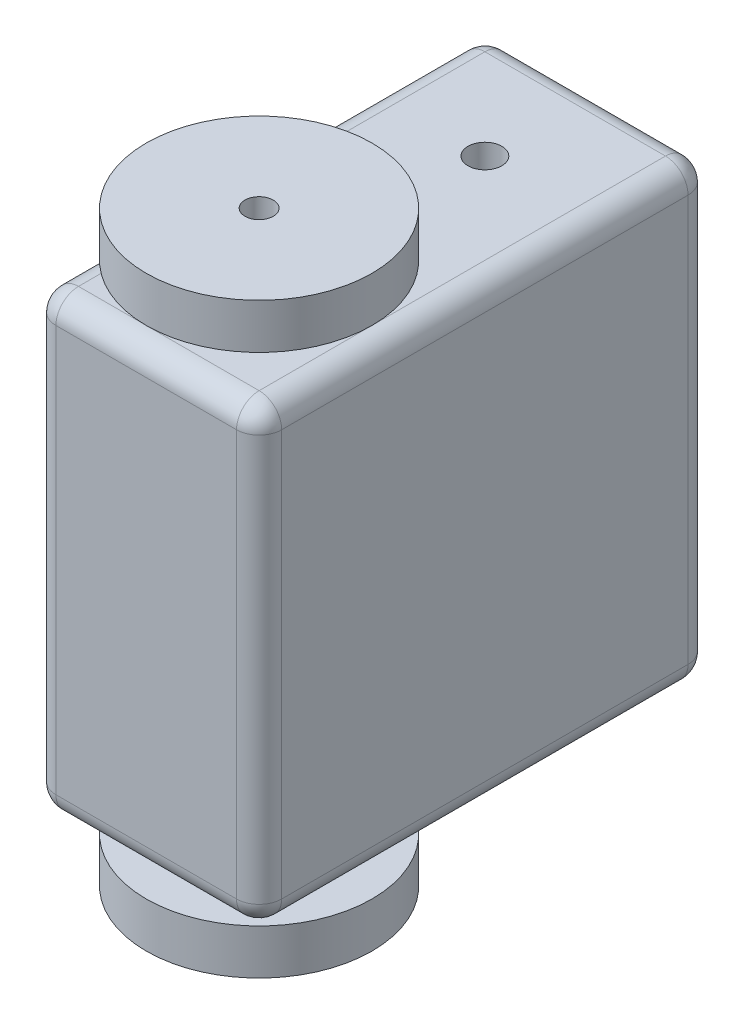
from build123d import *

# Parameters (mm, degrees)
SKETCH_1_W          = 40
SKETCH_1_H          = 40
EXTRUDE_1_DEPTH     = 10
SKETCH_2_R          = 5
EXTRUDE_2_DEPTH     = 1
SKETCH_3_R          = 2.5
EXTRUDE_3_DEPTH     = 1
SKETCH_4_R          = 10
EXTRUDE_4_DEPTH     = 4
CUT_EXTRUDE_START   = -46
SKETCH_5_R          = 1.25
CUT_EXTRUDE_1_DEPTH = 46
FILLET_1_R          = 2
SKETCH_6_R          = 1.5
CUT_EXTRUDE_2_DEPTH = 3


with BuildPart() as part:
    # 草图1 → 凸台-拉伸1 (new, symmetric)
    with BuildSketch(Plane(origin=(0, 0, 0), x_dir=(0, 0, -1), z_dir=(1, 0, 0))):
        Rectangle(SKETCH_1_W, SKETCH_1_H)
    extrude(amount=EXTRUDE_1_DEPTH, both=True)

    # 草图2 → 凸台-拉伸2 (add)
    with BuildSketch(Plane(origin=(0, 20, 0), x_dir=(1, 0, 0), z_dir=(0, 1, 0))):
        with Locations(Location((0, -10, 0), (0, 0, 90))):
            Circle(SKETCH_2_R)
    extrude_2 = extrude(amount=EXTRUDE_2_DEPTH)

    # 草图3 → 凸台-拉伸3 (add)
    with BuildSketch(Plane(origin=(0, 21, 0), x_dir=(1, 0, 0), z_dir=(0, 1, 0))):
        with Locations(Location((0, -10, 0), (0, 0, 270))):
            Circle(SKETCH_3_R)
    extrude_3 = extrude(amount=EXTRUDE_3_DEPTH)

    # 草图4 → 凸台-拉伸4 (add)
    with BuildSketch(Plane(origin=(0, 22, 0), x_dir=(1, 0, 0), z_dir=(0, 1, 0))):
        with Locations(Location((0, -10, 0), (0, 0, 270))):
            Circle(SKETCH_4_R)
    extrude_4 = extrude(amount=EXTRUDE_4_DEPTH)

    # 草图5 → 切除-拉伸1 (cut)
    with BuildSketch(Plane(origin=(0, 26, 0), x_dir=(1, 0, 0), z_dir=(0, 1, 0)).offset(CUT_EXTRUDE_START)):
        with Locations(Location((0, -10, 0), (0, 0, 270))):
            Circle(SKETCH_5_R)
    cut_extrude_1 = extrude(amount=CUT_EXTRUDE_1_DEPTH, mode=Mode.SUBTRACT)

    # 镜向1: 凸台-拉伸2, 凸台-拉伸3, 凸台-拉伸4, 切除-拉伸1 across plane
    add(extrude_2.mirror(Plane.ZX))
    add(extrude_3.mirror(Plane.ZX))
    add(extrude_4.mirror(Plane.ZX))
    add(cut_extrude_1.mirror(Plane.ZX), mode=Mode.SUBTRACT)

    # 圆角1
    # the kernel refuses this fillet: 2 mm, written as the material it adds along each edge
    with BuildSketch(Plane(origin=(0, 20, 10), x_dir=(0, 0, -1), z_dir=(1, 0, 0))) as fillet_1_piece_1:
        with BuildLine():
            CenterArc((6.732050808, 2), FILLET_1_R, 210, 60)
            Line((6.732050808, 0), (5, 0))
            Line((5, 0), (5, 1))
        make_face()
    revolve(axis=Axis((0, 20, 10), (0, 1, 0)))
    # the kernel refuses this fillet: 2 mm, written as the material it takes off along each edge
    with BuildSketch(Plane(origin=(8, 18, -18), x_dir=(0, 0, -1), z_dir=(0, 1, 0))) as fillet_1_2_piece_1_section:
        Polygon((0, 0), (FILLET_1_R * 1.02, 0), (FILLET_1_R * 1.02, -FILLET_1_R * 1.02), (0, -FILLET_1_R * 1.02), align=None)
    fillet_1_2_piece_1 = extrude(amount=FILLET_1_R * 1.02, mode=Mode.PRIVATE)
    fillet_1_2_piece_1 = fillet_1_2_piece_1 - Plane(origin=(8, 18, -18), x_dir=(-0.7071067811865475, 0, 0.7071067811865475), z_dir=(0, 1, 0)) * Sphere(FILLET_1_R, mode=Mode.PRIVATE)
    add(fillet_1_2_piece_1, mode=Mode.SUBTRACT)
    with BuildSketch(Plane(origin=(8, -18, -18), x_dir=(0, 0, -1), z_dir=(0, -1, 0))) as fillet_1_2_piece_2_section:
        Polygon((0, 0), (FILLET_1_R * 1.02, 0), (FILLET_1_R * 1.02, FILLET_1_R * 1.02), (0, FILLET_1_R * 1.02), align=None)
    fillet_1_2_piece_2 = extrude(amount=FILLET_1_R * 1.02, mode=Mode.PRIVATE)
    fillet_1_2_piece_2 = fillet_1_2_piece_2 - Plane(origin=(8, -18, -18), x_dir=(-0.7071067811865475, 0, 0.7071067811865475), z_dir=(0, -1, 0)) * Sphere(FILLET_1_R, mode=Mode.PRIVATE)
    add(fillet_1_2_piece_2, mode=Mode.SUBTRACT)
    with BuildSketch(Plane(origin=(8, 18, 18), x_dir=(1, 0, 0), z_dir=(0, 1, 0))) as fillet_1_2_piece_3_section:
        Polygon((0, 0), (FILLET_1_R * 1.02, 0), (FILLET_1_R * 1.02, -FILLET_1_R * 1.02), (0, -FILLET_1_R * 1.02), align=None)
    fillet_1_2_piece_3 = extrude(amount=FILLET_1_R * 1.02, mode=Mode.PRIVATE)
    fillet_1_2_piece_3 = fillet_1_2_piece_3 - Plane(origin=(8, 18, 18), x_dir=(-0.7071067811865475, 0, -0.7071067811865475), z_dir=(0, 1, 0)) * Sphere(FILLET_1_R, mode=Mode.PRIVATE)
    add(fillet_1_2_piece_3, mode=Mode.SUBTRACT)
    with BuildSketch(Plane(origin=(8, -18, 18), x_dir=(1, 0, 0), z_dir=(0, -1, 0))) as fillet_1_2_piece_4_section:
        Polygon((0, 0), (FILLET_1_R * 1.02, 0), (FILLET_1_R * 1.02, FILLET_1_R * 1.02), (0, FILLET_1_R * 1.02), align=None)
    fillet_1_2_piece_4 = extrude(amount=FILLET_1_R * 1.02, mode=Mode.PRIVATE)
    fillet_1_2_piece_4 = fillet_1_2_piece_4 - Plane(origin=(8, -18, 18), x_dir=(-0.7071067811865475, 0, -0.7071067811865475), z_dir=(0, -1, 0)) * Sphere(FILLET_1_R, mode=Mode.PRIVATE)
    add(fillet_1_2_piece_4, mode=Mode.SUBTRACT)
    with BuildSketch(Plane(origin=(-8, 18, 18), x_dir=(-1, 0, 0), z_dir=(0, 1, 0))) as fillet_1_2_piece_5_section:
        Polygon((0, 0), (FILLET_1_R * 1.02, 0), (FILLET_1_R * 1.02, FILLET_1_R * 1.02), (0, FILLET_1_R * 1.02), align=None)
    fillet_1_2_piece_5 = extrude(amount=FILLET_1_R * 1.02, mode=Mode.PRIVATE)
    fillet_1_2_piece_5 = fillet_1_2_piece_5 - Plane(origin=(-8, 18, 18), x_dir=(0.7071067811865475, 0, -0.7071067811865475), z_dir=(0, 1, 0)) * Sphere(FILLET_1_R, mode=Mode.PRIVATE)
    add(fillet_1_2_piece_5, mode=Mode.SUBTRACT)
    with BuildSketch(Plane(origin=(-8, 18, -18), x_dir=(0, 0, -1), z_dir=(0, 1, 0))) as fillet_1_2_piece_6_section:
        Polygon((0, 0), (FILLET_1_R * 1.02, 0), (FILLET_1_R * 1.02, FILLET_1_R * 1.02), (0, FILLET_1_R * 1.02), align=None)
    fillet_1_2_piece_6 = extrude(amount=FILLET_1_R * 1.02, mode=Mode.PRIVATE)
    fillet_1_2_piece_6 = fillet_1_2_piece_6 - Plane(origin=(-8, 18, -18), x_dir=(0.7071067811865475, 0, 0.7071067811865475), z_dir=(0, 1, 0)) * Sphere(FILLET_1_R, mode=Mode.PRIVATE)
    add(fillet_1_2_piece_6, mode=Mode.SUBTRACT)
    with BuildSketch(Plane(origin=(-8, -18, -18), x_dir=(0, 0, -1), z_dir=(0, -1, 0))) as fillet_1_2_piece_7_section:
        Polygon((0, 0), (FILLET_1_R * 1.02, 0), (FILLET_1_R * 1.02, -FILLET_1_R * 1.02), (0, -FILLET_1_R * 1.02), align=None)
    fillet_1_2_piece_7 = extrude(amount=FILLET_1_R * 1.02, mode=Mode.PRIVATE)
    fillet_1_2_piece_7 = fillet_1_2_piece_7 - Plane(origin=(-8, -18, -18), x_dir=(0.7071067811865475, 0, 0.7071067811865475), z_dir=(0, -1, 0)) * Sphere(FILLET_1_R, mode=Mode.PRIVATE)
    add(fillet_1_2_piece_7, mode=Mode.SUBTRACT)
    with BuildSketch(Plane(origin=(-8, -18, 18), x_dir=(-1, 0, 0), z_dir=(0, -1, 0))) as fillet_1_2_piece_8_section:
        Polygon((0, 0), (FILLET_1_R * 1.02, 0), (FILLET_1_R * 1.02, -FILLET_1_R * 1.02), (0, -FILLET_1_R * 1.02), align=None)
    fillet_1_2_piece_8 = extrude(amount=FILLET_1_R * 1.02, mode=Mode.PRIVATE)
    fillet_1_2_piece_8 = fillet_1_2_piece_8 - Plane(origin=(-8, -18, 18), x_dir=(0.7071067811865475, 0, -0.7071067811865475), z_dir=(0, -1, 0)) * Sphere(FILLET_1_R, mode=Mode.PRIVATE)
    add(fillet_1_2_piece_8, mode=Mode.SUBTRACT)
    with BuildSketch(Plane(origin=(10, 18, -20), x_dir=(-1, 0, 0), z_dir=(0, -1, 0)), Plane(origin=(-10, 20, 18), x_dir=(0, -1, 0), z_dir=(0, 0, -1)), Plane(origin=(-10, -18, 20), x_dir=(0, 0, -1), z_dir=(0, 1, 0)), Plane(origin=(10, -20, -18), x_dir=(-1, 0, 0), z_dir=(0, 0, 1))) as fillet_1_2_piece_9:
        with BuildLine():
            CenterArc((FILLET_1_R, -FILLET_1_R), FILLET_1_R, 90, 90)
            Line((0, -FILLET_1_R), (0, 0))
            Line((0, 0), (FILLET_1_R, 0))
        make_face()
    extrude(amount=36, mode=Mode.SUBTRACT)
    with BuildSketch(Plane(origin=(10, 20, 18), x_dir=(0, -1, 0), z_dir=(0, 0, -1)), Plane(origin=(10, -18, 20), x_dir=(0, 0, -1), z_dir=(0, 1, 0)), Plane(origin=(-10, 18, -20), x_dir=(1, 0, 0), z_dir=(0, -1, 0)), Plane(origin=(-10, -20, -18), x_dir=(1, 0, 0), z_dir=(0, 0, 1))) as fillet_1_2_piece_10:
        with BuildLine():
            CenterArc((FILLET_1_R, FILLET_1_R), FILLET_1_R, 180, 90)
            Line((0, FILLET_1_R), (0, 0))
            Line((0, 0), (FILLET_1_R, 0))
        make_face()
    extrude(amount=36, mode=Mode.SUBTRACT)
    with BuildSketch(Plane(origin=(8, 20, 20), x_dir=(0, -1, 0), z_dir=(-1, 0, 0)), Plane(origin=(-8, 20, -20), x_dir=(0, -1, 0), z_dir=(1, 0, 0)), Plane(origin=(-8, -20, -20), x_dir=(0, 0, 1), z_dir=(1, 0, 0)), Plane(origin=(8, -20, 20), x_dir=(0, 0, -1), z_dir=(-1, 0, 0))) as fillet_1_2_piece_11:
        with BuildLine():
            CenterArc((FILLET_1_R, -FILLET_1_R), FILLET_1_R, 90, 90)
            Line((0, -FILLET_1_R), (0, 0))
            Line((0, 0), (FILLET_1_R, 0))
        make_face()
    extrude(amount=16, mode=Mode.SUBTRACT)

    # 草图6 → 切除-拉伸2 (cut)
    with BuildSketch(Plane(origin=(0, 20, 0), x_dir=(1, 0, 0), z_dir=(0, 1, 0))):
        with Locations(Location((0, 10, 0), (0, 0, 270))):
            Circle(SKETCH_6_R)
    cut_extrude_2 = extrude(amount=-CUT_EXTRUDE_2_DEPTH, mode=Mode.SUBTRACT)

    # 镜向2: 切除-拉伸2 across plane
    add(cut_extrude_2.mirror(Plane.ZX), mode=Mode.SUBTRACT)


solid = part.part
